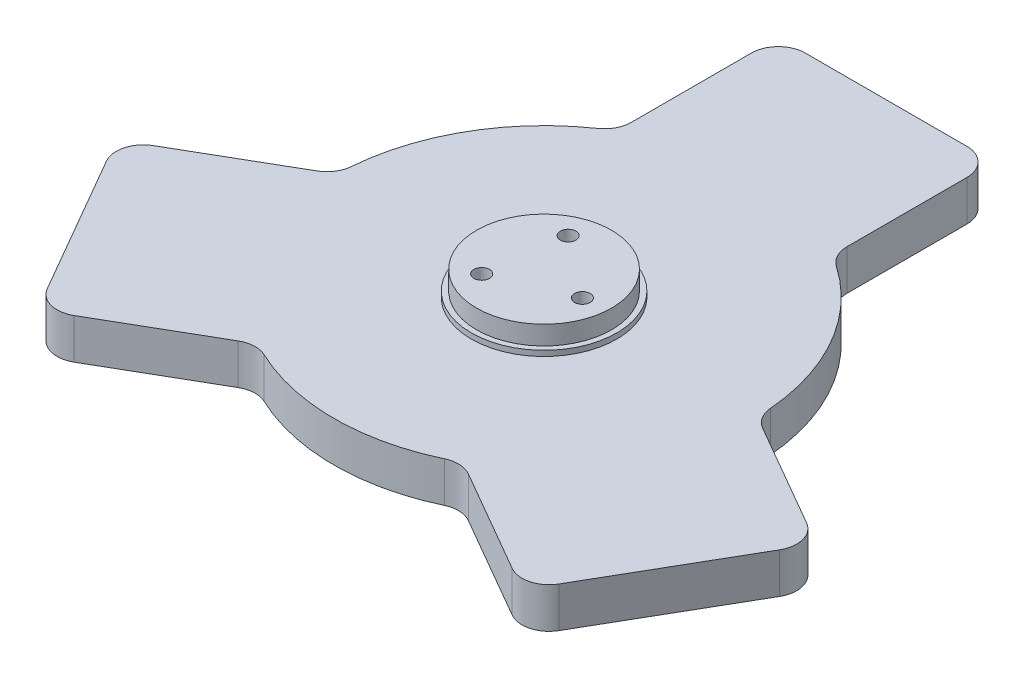
from build123d import *

# Parameters (mm, degrees)
BOSS_EXTRUDE1_DEPTH           = 15
SKETCH2_R                     = 27
BOSS_EXTRUDE2_DEPTH           = 2
SKETCH3_R                     = 25.05
BOSS_EXTRUDE3_DEPTH           = 7
CBORE_FOR_M5_SHCS1_AT_2_COUNT = 2
CBORE_FOR_M5_SHCS1_AT_2_PITCH = 28.596158833
CBORE_FOR_M5_SHCS1_AT_3_COUNT = 2
CBORE_FOR_M5_SHCS1_AT_3_PITCH = 28.596158833
FILLET1_R                     = 10


with BuildPart() as part:
    # Sketch1 → Boss-Extrude1 (new body)
    with BuildSketch(Plane(origin=(0, 0, 0), x_dir=(1, 0, 0), z_dir=(0, 1, 0))):
        with BuildLine():
            Line((-40, 126.962676171), (-40, 66.962676171))
            ThreePointArc((-40, 66.962676171), (-67.549981495, 39), (-77.99137867, 1.159678066))
            Line((-77.99137867, 1.159678066), (-129.952902897, -28.840321934))
            Line((-129.952902897, -28.840321934), (-89.952902897, -98.122354237))
            Line((-89.952902897, -98.122354237), (-37.99137867, -68.122354237))
            ThreePointArc((-37.99137867, -68.122354237), (0, -78), (37.99137867, -68.122354237))
            Line((37.99137867, -68.122354237), (89.952902897, -98.122354237))
            Line((89.952902897, -98.122354237), (129.952902897, -28.840321934))
            Line((129.952902897, -28.840321934), (77.99137867, 1.159678066))
            ThreePointArc((77.99137867, 1.159678066), (67.549981495, 39), (40, 66.962676171))
            Line((40, 66.962676171), (40, 126.962676171))
            Line((40, 126.962676171), (-40, 126.962676171))
        make_face()
    extrude(amount=BOSS_EXTRUDE1_DEPTH)

    # Sketch2 → Boss-Extrude2 (add)
    with BuildSketch(Plane(origin=(0, 15, 0), x_dir=(1, 0, 0), z_dir=(0, 1, 0))):
        Circle(SKETCH2_R)
    extrude(amount=BOSS_EXTRUDE2_DEPTH)

    # Sketch3 → Boss-Extrude3 (add)
    with BuildSketch(Plane(origin=(0, 17, 0), x_dir=(1, 0, 0), z_dir=(0, 1, 0))):
        Circle(SKETCH3_R)
    extrude(amount=BOSS_EXTRUDE3_DEPTH)

    # Sketch5 → CBORE for M5 SHCS1 (revolve, cut)
    with BuildSketch(Plane(origin=(16.368754661, 0, 2.154987434), x_dir=(0, 0, -1), z_dir=(1, 0, 0))):
        Polygon((0, 0), (0, 24), (2.9, 24), (2.9, 5), (5, 5), (5, 0.025), (5.025, 0), align=None)
    cbore_for_m5_shcs1 = revolve(axis=Axis((16.368754661, -6.35, 2.154987434), (0, 1, 0)), mode=Mode.SUBTRACT)

    # CBORE for M5 SHCS1 at 2: CBORE for M5 SHCS1 ×2
    with Locations(*[Vector(-0.7933533402912365, 0, -0.608761429008719) * (i * CBORE_FOR_M5_SHCS1_AT_2_PITCH) for i in range(1, CBORE_FOR_M5_SHCS1_AT_2_COUNT)]):
        add(cbore_for_m5_shcs1, mode=Mode.SUBTRACT)

    # CBORE for M5 SHCS1 at 3: CBORE for M5 SHCS1 ×2
    with Locations(*[Vector(-0.9238795325112866, 0, 0.38268343236509017) * (i * CBORE_FOR_M5_SHCS1_AT_3_PITCH) for i in range(1, CBORE_FOR_M5_SHCS1_AT_3_COUNT)]):
        add(cbore_for_m5_shcs1, mode=Mode.SUBTRACT)

    # Fillet1
    fillet1_edges = [part.edges().sort_by_distance(p)[0] for p in [
        (40, 7.5, -66.962676171),
        (-40, 7.5, -66.962676171),
        (40, 7.5, -126.962676171),
        (-40, 7.5, -126.962676171),
        (77.99137867, 7.5, -1.159678066),
        (129.952902897, 7.5, 28.840321934),
        (89.952902897, 7.5, 98.122354237),
        (37.99137867, 7.5, 68.122354237),
        (-37.99137867, 7.5, 68.122354237),
        (-89.952902897, 7.5, 98.122354237),
        (-129.952902897, 7.5, 28.840321934),
        (-77.99137867, 7.5, -1.159678066),
    ]]
    fillet(fillet1_edges, radius=FILLET1_R)


solid = part.part
